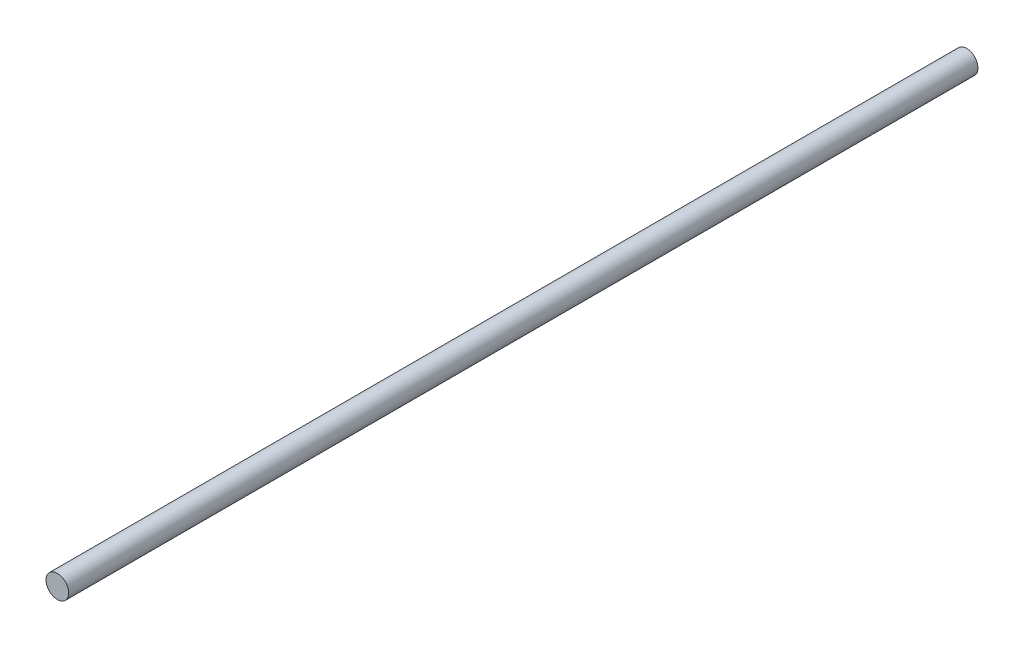
from build123d import *

# Parameters (mm, degrees)
SKETCH1_R           = 1.25
BOSS_EXTRUDE1_DEPTH = 50


with BuildPart() as part:
    # Sketch1 → Boss-Extrude1 (new, symmetric)
    with BuildSketch(Plane.XY):
        Circle(SKETCH1_R)
    extrude(amount=BOSS_EXTRUDE1_DEPTH, both=True)


solid = part.part
